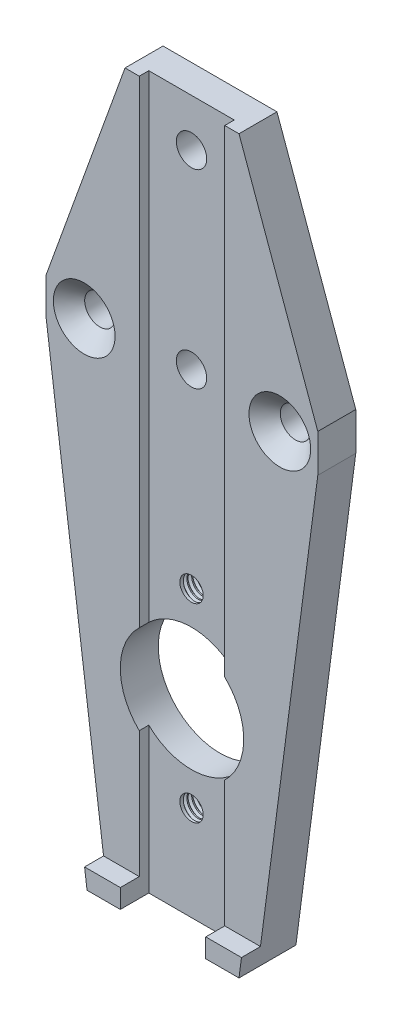
from build123d import *

# Parameters (mm, degrees)
MODEL_R                   = 1.229367
EXTRUDE_1_DEPTH           = 3
MODEL_R_2                 = 1.6
EXTRUDE_1_2_DEPTH         = 3
MODEL_3_R                 = 3.25
MODEL_3_R_2               = 1.6
EXTRUDE_2_DEPTH           = 4
EXTRUDE_3_DEPTH           = 6
HOLE_WIZARD_1_D           = 3.2
HOLE_WIZARD_1_CSINK_D     = 6.5
HOLE_WIZARD_1_CSINK_ANGLE = 90
THREAD_4_PITCH            = 0.5
THREAD_5_PITCH            = 0.5


with BuildPart() as part:
    # Model → 凸台-拉伸1 (new body)
    with BuildSketch(Plane.XY):
        with BuildLine():
            Line((-22.966634219, 4.228876834), (-22.966634219, -11.080707406))
            Line((-22.966634219, -11.080707406), (-13.966634219, -11.080707406))
            Line((-13.966634219, -11.080707406), (-13.966634219, 4.228876834))
            ThreePointArc((-13.966634219, 4.228876834), (-18.466634219, 2.419292594), (-22.966634219, 4.228876834))
        make_face()
        with Locations((-18.466634219, -1.080707406)):
            Circle(MODEL_R, mode=Mode.SUBTRACT)
    extrude(amount=EXTRUDE_1_DEPTH)



with BuildPart() as body_2:
    # Model → Extrude 1 2 (new body)
    with BuildSketch(Plane.XY):
        with BuildLine():
            Line((-22.966634219, 63.919292594), (-22.966634219, 13.609708354))
            ThreePointArc((-22.966634219, 13.609708354), (-18.466634219, 15.419292594), (-13.966634219, 13.609708354))
            Line((-13.966634219, 13.609708354), (-13.966634219, 63.919292594))
            Line((-13.966634219, 63.919292594), (-22.966634219, 63.919292594))
        make_face()
        with Locations((-18.466634219, 18.919292594)):
            Circle(MODEL_R, mode=Mode.SUBTRACT)
        with Locations((-18.466634219, 38.919292594)):
            Circle(MODEL_R_2, mode=Mode.SUBTRACT)
        with Locations((-18.466634219, 58.919292594)):
            Circle(MODEL_R_2, mode=Mode.SUBTRACT)
    extrude(amount=EXTRUDE_1_2_DEPTH)


with BuildPart() as part_1:
    add(part.part)

    add(body_2.part)  # 凸台-拉伸2 merges body 2
    # Model<3> → 凸台-拉伸2 (add)
    # profile 1 of 8: a face of its own
    with BuildSketch(Plane.XY):
        with BuildLine():
            Line((-26.729134219, -9.080707406), (-22.966634219, -9.080707406))
            Line((-22.966634219, -9.080707406), (-22.966634219, 4.228876834))
            ThreePointArc((-22.966634219, 4.228876834), (-24.966634219, 8.919292594), (-22.966634219, 13.609708354))
            Line((-22.966634219, 13.609708354), (-22.966634219, 63.919292594))
            Line((-22.966634219, 63.919292594), (-24.466634219, 63.919292594))
            Line((-24.466634219, 63.919292594), (-32.766634219, 40.919292594))
            Line((-32.766634219, 40.919292594), (-32.766634219, 36.919292594))
            Line((-32.766634219, 36.919292594), (-26.729134219, -9.080707406))
        make_face()
        with Locations((-28.766634219, 38.919292594)):
            Circle(MODEL_3_R, mode=Mode.SUBTRACT)
    # profile 2 of 8: a face of its own
    with BuildSketch(Plane.XY):
        with BuildLine():
            Line((-13.966634219, 4.228876834), (-13.966634219, -9.080707406))
            Line((-13.966634219, -9.080707406), (-10.204134219, -9.080707406))
            Line((-10.204134219, -9.080707406), (-4.166634219, 36.919292594))
            Line((-4.166634219, 36.919292594), (-4.166634219, 40.919292594))
            Line((-4.166634219, 40.919292594), (-12.466634219, 63.919292594))
            Line((-12.466634219, 63.919292594), (-13.966634219, 63.919292594))
            Line((-13.966634219, 63.919292594), (-13.966634219, 13.609708354))
            ThreePointArc((-13.966634219, 13.609708354), (-12.487503847, 11.468802351), (-11.966634219, 8.919292594))
            ThreePointArc((-11.966634219, 8.919292594), (-12.487503847, 6.369782837), (-13.966634219, 4.228876834))
        make_face()
        with Locations((-8.166634219, 38.919292594)):
            Circle(MODEL_3_R, mode=Mode.SUBTRACT)
    # profile 3 of 8: a face of its own
    with BuildSketch(Plane.XY):
        with Locations((-28.766634219, 38.919292594)):
            Circle(MODEL_3_R)
        with Locations((-28.766634219, 38.919292594)):
            Circle(MODEL_3_R_2, mode=Mode.SUBTRACT)
    # profile 4 of 8: a face of its own
    with BuildSketch(Plane.XY):
        with Locations((-28.766634219, 38.919292594)):
            Circle(MODEL_3_R_2)
    # profile 5 of 8: a face of its own
    with BuildSketch(Plane.XY):
        with Locations((-8.166634219, 38.919292594)):
            Circle(MODEL_3_R)
        with Locations((-8.166634219, 38.919292594)):
            Circle(MODEL_3_R_2, mode=Mode.SUBTRACT)
    # profile 6 of 8: a face of its own
    with BuildSketch(Plane.XY):
        with Locations((-8.166634219, 38.919292594)):
            Circle(MODEL_3_R_2)
    # profile 7 of 8: a face of its own
    with BuildSketch(Plane.XY):
        Polygon((-26.466634219, -11.080707406), (-22.966634219, -11.080707406), (-22.966634219, -9.080707406), (-26.729134219, -9.080707406), align=None)
    # profile 8 of 8: a face of its own
    with BuildSketch(Plane.XY):
        Polygon((-13.966634219, -9.080707406), (-13.966634219, -11.080707406), (-10.466634219, -11.080707406), (-10.204134219, -9.080707406), align=None)
    extrude(amount=EXTRUDE_2_DEPTH)

    # Model<4> → 凸台-拉伸3 (add)
    with BuildSketch(Plane.XY):
        Polygon((-26.466634219, -11.080707406), (-22.966634219, -11.080707406), (-22.966634219, -9.080707406), (-26.729134219, -9.080707406), align=None)
        Polygon((-13.966634219, -9.080707406), (-13.966634219, -11.080707406), (-10.466634219, -11.080707406), (-10.204134219, -9.080707406), align=None)
    extrude(amount=EXTRUDE_3_DEPTH)

    # 打孔尺寸(%根据)内六角花形半沉头螺钉的类型1 (through all)
    with Locations(Plane(origin=(-28.766634219, 38.919292594, 4), x_dir=(1, 0, 0), z_dir=(0, 0, 1))):
        with Locations((0, 0), (20.6, 0)):
            CounterSinkHole(HOLE_WIZARD_1_D / 2, HOLE_WIZARD_1_CSINK_D / 2, counter_sink_angle=HOLE_WIZARD_1_CSINK_ANGLE)

    # 螺纹线4: the profile of 螺纹线轮廓4 profile screwed along a right-hand helix of 5.25 turns, 6 arcs to a turn; built about Z, then put on its axis
    thread_4_z = Axis((0, 0, 0), (0, 0, 1))
    thread_4_corners = [(1.229067, 0, -0.000173205), (1.499999938, 0, 0.156249999), (1.499999938, 0, 0.218749999), (1.229067, 0, 0.375173204)]
    with BuildLine(mode=Mode.PRIVATE) as thread_4_profile:
        Line(thread_4_corners[0], thread_4_corners[1])
        Line(thread_4_corners[1], thread_4_corners[2])
        Line(thread_4_corners[2], thread_4_corners[3])
        Line(thread_4_corners[3], thread_4_corners[0])
    thread_4_cap = Face(thread_4_profile.wire())
    thread_4_turn_angles = [0, 30, 60, 90, 120, 150, 180, 210, 240, 270, 300, 330, 360]
    thread_4_turn_weights = [1, 0.8660254037844387, 1, 0.8660254037844387, 1, 0.8660254037844387, 1, 0.8660254037844387, 1, 0.8660254037844387, 1, 0.8660254037844387, 1]
    thread_4_turn_rails = [Edge.make_bspline([Vector(p[0], p[1], 0).rotate(thread_4_z, thread_4_turn_angles[k]) / thread_4_turn_weights[k] + Vector(0, 0, p[2] + THREAD_4_PITCH * thread_4_turn_angles[k] / 360) for k in range(13)], [0, 0, 0, 1, 1, 2, 2, 3, 3, 4, 4, 5, 5, 6, 6, 6], 2, thread_4_turn_weights) for p in thread_4_corners]
    thread_4_turn_sides = [Face.make_surface_from_curves(thread_4_turn_rails[p[0]], thread_4_turn_rails[p[1]]) for p in [(0, 1), (1, 2), (2, 3), (3, 0)]]
    thread_4_last_angles = [1800, 1830, 1860, 1875, 1890]
    thread_4_last_weights = [1, 0.8660254037844387, 1, 0.9659258262890683, 1]
    thread_4_last_rails = [Edge.make_bspline([Vector(p[0], p[1], 0).rotate(thread_4_z, thread_4_last_angles[k]) / thread_4_last_weights[k] + Vector(0, 0, p[2] + THREAD_4_PITCH * thread_4_last_angles[k] / 360) for k in range(5)], [0, 0, 0, 1, 1, 2, 2, 2], 2, thread_4_last_weights) for p in thread_4_corners]
    thread_4_last_sides = [Face.make_surface_from_curves(thread_4_last_rails[p[0]], thread_4_last_rails[p[1]]) for p in [(0, 1), (1, 2), (2, 3), (3, 0)]]
    thread_4 = Plane(origin=(-18.466634219, 18.919292594, 0), x_dir=(1, 0, 0), z_dir=(0, 0, 1)) * Solid(Shell([*[p.moved(Location((0, 0, THREAD_4_PITCH * i))) for i in range(5) for p in thread_4_turn_sides], *thread_4_last_sides, thread_4_cap, thread_4_cap.rotate(thread_4_z, 1890).moved(Location((0, 0, THREAD_4_PITCH * 1890 / 360)))]))
    add(thread_4, mode=Mode.SUBTRACT)

    # 螺纹线5: the profile of 螺纹线轮廓5 profile screwed along a right-hand helix of 5.25 turns, 6 arcs to a turn; built about Z, then put on its axis
    thread_5_z = Axis((0, 0, 0), (0, 0, 1))
    thread_5_corners = [(1.229067, 0, -0.000173205), (1.499999938, 0, 0.156249999), (1.499999938, 0, 0.218749999), (1.229067, 0, 0.375173204)]
    with BuildLine(mode=Mode.PRIVATE) as thread_5_profile:
        Line(thread_5_corners[0], thread_5_corners[1])
        Line(thread_5_corners[1], thread_5_corners[2])
        Line(thread_5_corners[2], thread_5_corners[3])
        Line(thread_5_corners[3], thread_5_corners[0])
    thread_5_cap = Face(thread_5_profile.wire())
    thread_5_turn_angles = [0, 30, 60, 90, 120, 150, 180, 210, 240, 270, 300, 330, 360]
    thread_5_turn_weights = [1, 0.8660254037844387, 1, 0.8660254037844387, 1, 0.8660254037844387, 1, 0.8660254037844387, 1, 0.8660254037844387, 1, 0.8660254037844387, 1]
    thread_5_turn_rails = [Edge.make_bspline([Vector(p[0], p[1], 0).rotate(thread_5_z, thread_5_turn_angles[k]) / thread_5_turn_weights[k] + Vector(0, 0, p[2] + THREAD_5_PITCH * thread_5_turn_angles[k] / 360) for k in range(13)], [0, 0, 0, 1, 1, 2, 2, 3, 3, 4, 4, 5, 5, 6, 6, 6], 2, thread_5_turn_weights) for p in thread_5_corners]
    thread_5_turn_sides = [Face.make_surface_from_curves(thread_5_turn_rails[p[0]], thread_5_turn_rails[p[1]]) for p in [(0, 1), (1, 2), (2, 3), (3, 0)]]
    thread_5_last_angles = [1800, 1830, 1860, 1875, 1890]
    thread_5_last_weights = [1, 0.8660254037844387, 1, 0.9659258262890683, 1]
    thread_5_last_rails = [Edge.make_bspline([Vector(p[0], p[1], 0).rotate(thread_5_z, thread_5_last_angles[k]) / thread_5_last_weights[k] + Vector(0, 0, p[2] + THREAD_5_PITCH * thread_5_last_angles[k] / 360) for k in range(5)], [0, 0, 0, 1, 1, 2, 2, 2], 2, thread_5_last_weights) for p in thread_5_corners]
    thread_5_last_sides = [Face.make_surface_from_curves(thread_5_last_rails[p[0]], thread_5_last_rails[p[1]]) for p in [(0, 1), (1, 2), (2, 3), (3, 0)]]
    thread_5 = Plane(origin=(-18.466634219, -1.080707406, 0), x_dir=(1, 0, 0), z_dir=(0, 0, 1)) * Solid(Shell([*[p.moved(Location((0, 0, THREAD_5_PITCH * i))) for i in range(5) for p in thread_5_turn_sides], *thread_5_last_sides, thread_5_cap, thread_5_cap.rotate(thread_5_z, 1890).moved(Location((0, 0, THREAD_5_PITCH * 1890 / 360)))]))
    add(thread_5, mode=Mode.SUBTRACT)


solid = part_1.part
